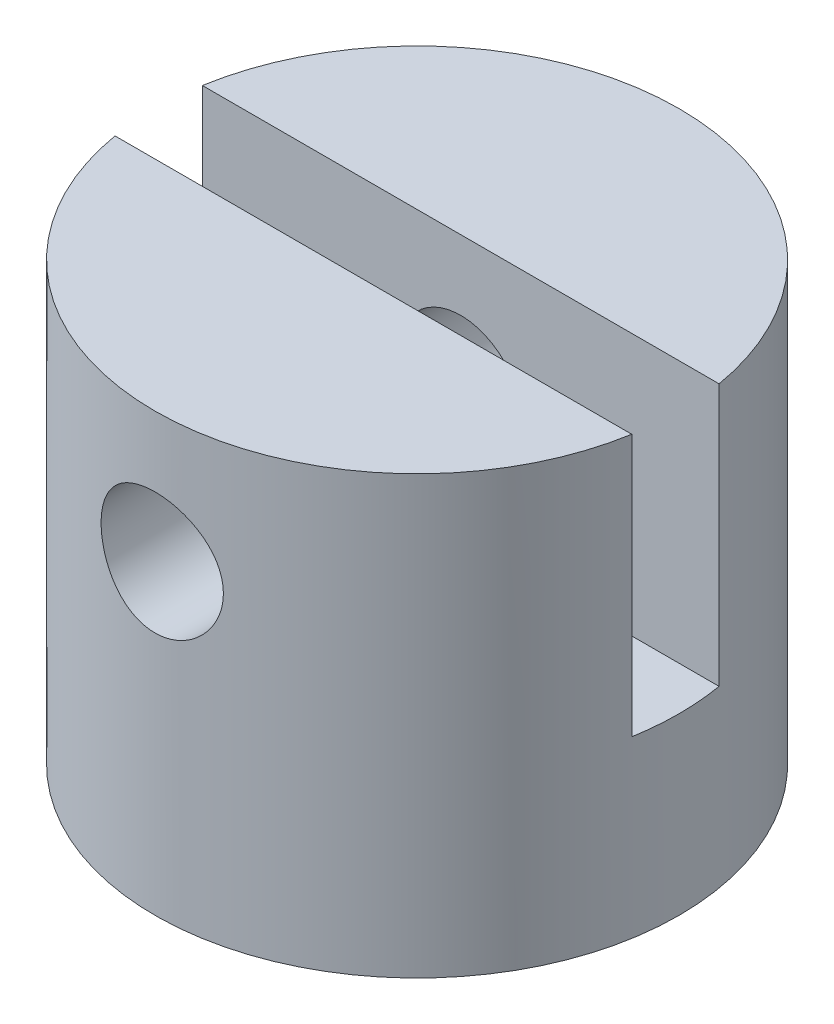
from build123d import *

# Parameters (mm, degrees)
SKETCH1_W               = 15
SKETCH1_H               = 25
SKETCH2_R               = 5
BOSS_EXTRUDE2_DEPTH     = 5
SKETCH4_W               = 30
SKETCH4_H               = 15
CUT_EXTRUDE1_DEPTH      = 2.5
CUT_EXTRUDE2_DEPTH      = 28.5
CUT_EXTRUDE2_DEPTH_BACK = 28.5
SKETCH5_R               = 3.5


with BuildPart() as part:
    # Sketch1 → Revolve1 (revolve)
    with BuildSketch(Plane.XY):
        with Locations((7.5, 0)):
            Rectangle(SKETCH1_W, SKETCH1_H)
    revolve(axis=Axis((0, -12.5, 0), (0, 1, 0)))

    # Sketch2 → Boss-Extrude2 (add)
    with BuildSketch(Plane.XZ.offset(12.5)):
        Circle(SKETCH2_R)
    extrude(amount=BOSS_EXTRUDE2_DEPTH)

    # Sketch4 → Cut-Extrude1 (cut, symmetric)
    with BuildSketch(Plane.XY):
        with Locations((0, 5)):
            Rectangle(SKETCH4_W, SKETCH4_H)
    extrude(amount=CUT_EXTRUDE1_DEPTH, both=True, mode=Mode.SUBTRACT)

    # Sketch5 → Cut-Extrude2 (cut, two sides: drawn at the far end of the back side and taken through both)
    with BuildSketch(Plane.XY.offset(-CUT_EXTRUDE2_DEPTH_BACK)):
        with Locations((0, 5)):
            Circle(SKETCH5_R)
    extrude(amount=CUT_EXTRUDE2_DEPTH + CUT_EXTRUDE2_DEPTH_BACK, mode=Mode.SUBTRACT)


solid = part.part
